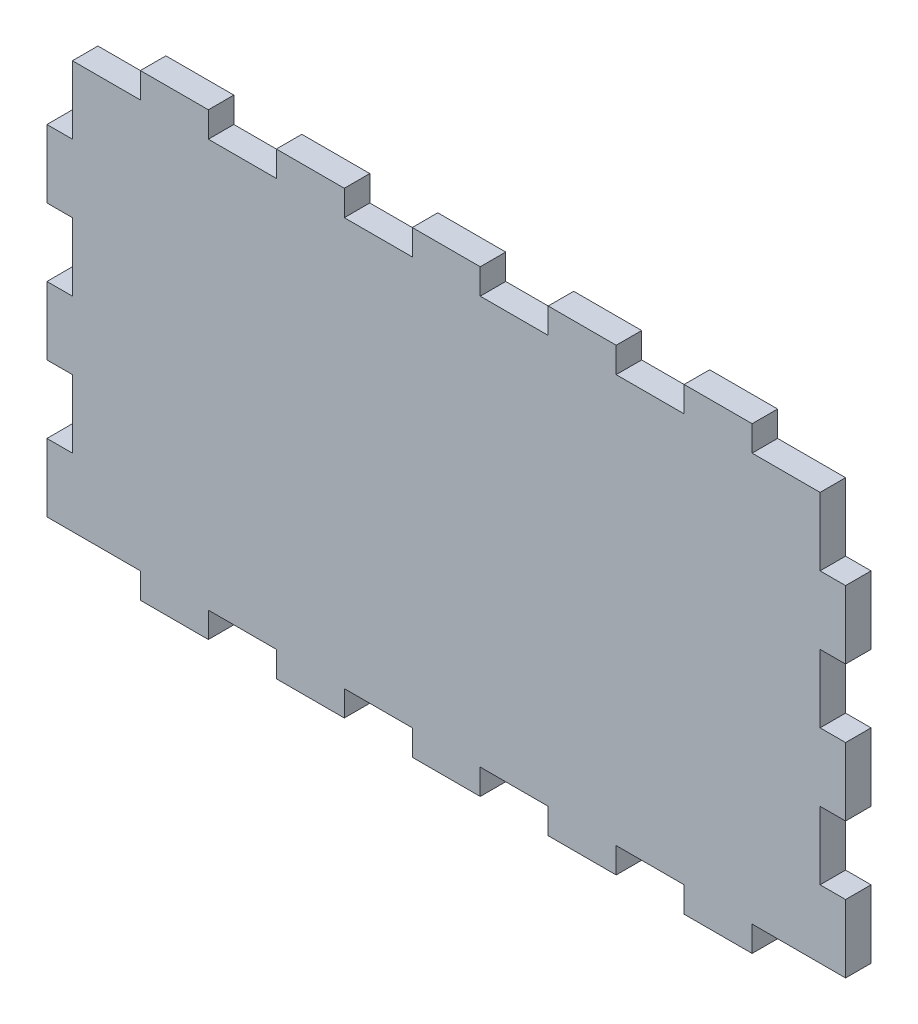
from build123d import *

# Parameters (mm, degrees)
SKETCH1_W               = 279.4
SKETCH1_H               = 152.4
BOSS_EXTRUDE1_DEPTH     = 9.525
SKETCH2_W               = 25.4
SKETCH2_H               = 9.525
BOSS_EXTRUDE2_DEPTH     = 9.525
LPATTERN1_COUNT         = 5
LPATTERN1_PITCH         = 50.8
MIRROR1_COPY_1_SKETCH_W = 25.4
MIRROR1_COPY_1_SKETCH_H = 9.525
MIRROR1_COPY_1_DEPTH    = 9.525
MIRROR1_COPY_2_SKETCH_W = 25.4
MIRROR1_COPY_2_SKETCH_H = 9.525
MIRROR1_COPY_2_DEPTH    = 9.525
MIRROR1_COPY_3_SKETCH_W = 25.4
MIRROR1_COPY_3_SKETCH_H = 9.525
MIRROR1_COPY_3_DEPTH    = 9.525
MIRROR1_COPY_4_SKETCH_W = 25.4
MIRROR1_COPY_4_SKETCH_H = 9.525
MIRROR1_COPY_4_DEPTH    = 9.525
MIRROR1_COPY_5_SKETCH_W = 25.4
MIRROR1_COPY_5_SKETCH_H = 9.525
MIRROR1_COPY_5_DEPTH    = 9.525
SKETCH3_W               = 9.525
SKETCH3_H               = 25.4
BOSS_EXTRUDE3_DEPTH     = 9.525
LPATTERN2_COUNT         = 3
LPATTERN2_PITCH         = 50.8
MIRROR2_COPY_1_SKETCH_W = 9.525
MIRROR2_COPY_1_SKETCH_H = 25.4
MIRROR2_COPY_1_DEPTH    = 9.525
MIRROR2_COPY_2_SKETCH_W = 9.525
MIRROR2_COPY_2_SKETCH_H = 25.4
MIRROR2_COPY_2_DEPTH    = 9.525
MIRROR2_COPY_3_SKETCH_W = 9.525
MIRROR2_COPY_3_SKETCH_H = 25.4
MIRROR2_COPY_3_DEPTH    = 9.525


with BuildPart() as part:
    # Sketch1 → Boss-Extrude1 (new body)
    with BuildSketch(Plane.XY):
        Rectangle(SKETCH1_W, SKETCH1_H)
    extrude(amount=BOSS_EXTRUDE1_DEPTH)

    # Sketch2 → Boss-Extrude2 (add)
    with BuildSketch(Plane.XZ.offset(76.2)):
        with Locations((-101.6, 4.7625)):
            Rectangle(SKETCH2_W, SKETCH2_H)
    boss_extrude2 = extrude(amount=BOSS_EXTRUDE2_DEPTH)

    # LPattern1: Boss-Extrude2 ×5
    with Locations(*[(i * LPATTERN1_PITCH, 0, 0) for i in range(1, LPATTERN1_COUNT)]):
        add(boss_extrude2)

    # Mirror1 copy 1 sketch → Mirror1 copy 1 (add)
    with BuildSketch(Plane(origin=(50.8, 76.2, 0), x_dir=(1, 0, 0), z_dir=(0, 1, 0))):
        with Locations((-101.6, -4.7625)):
            Rectangle(MIRROR1_COPY_1_SKETCH_W, MIRROR1_COPY_1_SKETCH_H)
    extrude(amount=MIRROR1_COPY_1_DEPTH)

    # Mirror1 copy 2 sketch → Mirror1 copy 2 (add)
    with BuildSketch(Plane(origin=(101.6, 76.2, 0), x_dir=(1, 0, 0), z_dir=(0, 1, 0))):
        with Locations((-101.6, -4.7625)):
            Rectangle(MIRROR1_COPY_2_SKETCH_W, MIRROR1_COPY_2_SKETCH_H)
    extrude(amount=MIRROR1_COPY_2_DEPTH)

    # Mirror1 copy 3 sketch → Mirror1 copy 3 (add)
    with BuildSketch(Plane(origin=(152.4, 76.2, 0), x_dir=(1, 0, 0), z_dir=(0, 1, 0))):
        with Locations((-101.6, -4.7625)):
            Rectangle(MIRROR1_COPY_3_SKETCH_W, MIRROR1_COPY_3_SKETCH_H)
    extrude(amount=MIRROR1_COPY_3_DEPTH)

    # Mirror1 copy 4 sketch → Mirror1 copy 4 (add)
    with BuildSketch(Plane(origin=(203.2, 76.2, 0), x_dir=(1, 0, 0), z_dir=(0, 1, 0))):
        with Locations((-101.6, -4.7625)):
            Rectangle(MIRROR1_COPY_4_SKETCH_W, MIRROR1_COPY_4_SKETCH_H)
    extrude(amount=MIRROR1_COPY_4_DEPTH)

    # Mirror1 copy 5 sketch → Mirror1 copy 5 (add)
    with BuildSketch(Plane(origin=(0, 76.2, 0), x_dir=(1, 0, 0), z_dir=(0, 1, 0))):
        with Locations((-101.6, -4.7625)):
            Rectangle(MIRROR1_COPY_5_SKETCH_W, MIRROR1_COPY_5_SKETCH_H)
    extrude(amount=MIRROR1_COPY_5_DEPTH)

    # Sketch3 → Boss-Extrude3 (add)
    with BuildSketch(Plane(origin=(139.7, 0, 0), x_dir=(0, 0, -1), z_dir=(1, 0, 0))):
        with Locations((-4.7625, -63.5)):
            Rectangle(SKETCH3_W, SKETCH3_H)
    boss_extrude3 = extrude(amount=BOSS_EXTRUDE3_DEPTH)

    # LPattern2: Boss-Extrude3 ×3
    with Locations(*[(0, i * LPATTERN2_PITCH, 0) for i in range(1, LPATTERN2_COUNT)]):
        add(boss_extrude3)

    # Mirror2 copy 1 sketch → Mirror2 copy 1 (add)
    with BuildSketch(Plane(origin=(-139.7, 50.8, 0), x_dir=(0, 0, -1), z_dir=(-1, 0, 0))):
        with Locations((-4.7625, 63.5)):
            Rectangle(MIRROR2_COPY_1_SKETCH_W, MIRROR2_COPY_1_SKETCH_H)
    extrude(amount=MIRROR2_COPY_1_DEPTH)

    # Mirror2 copy 2 sketch → Mirror2 copy 2 (add)
    with BuildSketch(Plane(origin=(-139.7, 101.6, 0), x_dir=(0, 0, -1), z_dir=(-1, 0, 0))):
        with Locations((-4.7625, 63.5)):
            Rectangle(MIRROR2_COPY_2_SKETCH_W, MIRROR2_COPY_2_SKETCH_H)
    extrude(amount=MIRROR2_COPY_2_DEPTH)

    # Mirror2 copy 3 sketch → Mirror2 copy 3 (add)
    with BuildSketch(Plane(origin=(-139.7, 0, 0), x_dir=(0, 0, -1), z_dir=(-1, 0, 0))):
        with Locations((-4.7625, 63.5)):
            Rectangle(MIRROR2_COPY_3_SKETCH_W, MIRROR2_COPY_3_SKETCH_H)
    extrude(amount=MIRROR2_COPY_3_DEPTH)


solid = part.part
